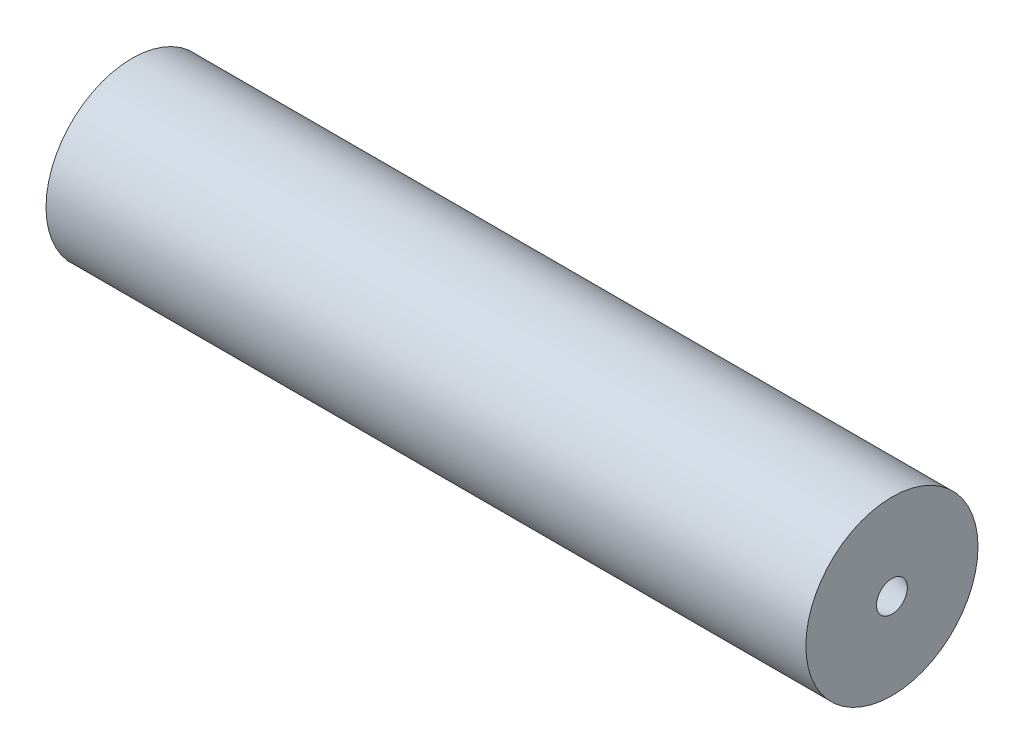
from build123d import *

# Parameters (mm, degrees)
CUT_EXTRUDE1_REACH = 247.25
SKETCH3_R          = 0.80645


with BuildPart() as part:
    # Sketch1 → Revolve1 (revolve)
    with BuildSketch(Plane.XY):
        Polygon((0, 12.7), (196.85, 12.7), (196.85, 26.162), (241.3, 26.162), (241.3, 0), (259.36, 0), (259.36, 10.7696), (273.6661, 5.5626), (273.6661, 31), (0, 31), align=None)
    revolve(axis=Axis((0, 0, 0), (1, 0, 0)))

    # Sketch3 → Cut-Extrude1 (cut, up to next)
    with BuildSketch(Plane.ZY.offset(-241.3), mode=Mode.PRIVATE) as cut_extrude1_sk1:
        with Locations((0, 6.477)):
            Circle(SKETCH3_R)
    cut_extrude1_tool1 = extrude(cut_extrude1_sk1.sketch, amount=-CUT_EXTRUDE1_REACH, mode=Mode.PRIVATE) & part.part
    # Sketch3 → Cut-Extrude1 (cut, up to next)
    with BuildSketch(Plane.ZY.offset(-241.3), mode=Mode.PRIVATE) as cut_extrude1_sk2:
        with Locations((4.579930622, 4.579930622)):
            Circle(SKETCH3_R)
    cut_extrude1_tool2 = extrude(cut_extrude1_sk2.sketch, amount=-CUT_EXTRUDE1_REACH, mode=Mode.PRIVATE) & part.part
    # Sketch3 → Cut-Extrude1 (cut, up to next)
    with BuildSketch(Plane.ZY.offset(-241.3), mode=Mode.PRIVATE) as cut_extrude1_sk3:
        with Locations((6.477, 0)):
            Circle(SKETCH3_R)
    cut_extrude1_tool3 = extrude(cut_extrude1_sk3.sketch, amount=-CUT_EXTRUDE1_REACH, mode=Mode.PRIVATE) & part.part
    # Sketch3 → Cut-Extrude1 (cut, up to next)
    with BuildSketch(Plane.ZY.offset(-241.3), mode=Mode.PRIVATE) as cut_extrude1_sk4:
        with Locations((4.579930622, -4.579930622)):
            Circle(SKETCH3_R)
    cut_extrude1_tool4 = extrude(cut_extrude1_sk4.sketch, amount=-CUT_EXTRUDE1_REACH, mode=Mode.PRIVATE) & part.part
    # Sketch3 → Cut-Extrude1 (cut, up to next)
    with BuildSketch(Plane.ZY.offset(-241.3), mode=Mode.PRIVATE) as cut_extrude1_sk5:
        with Locations((0, -6.477)):
            Circle(SKETCH3_R)
    cut_extrude1_tool5 = extrude(cut_extrude1_sk5.sketch, amount=-CUT_EXTRUDE1_REACH, mode=Mode.PRIVATE) & part.part
    # Sketch3 → Cut-Extrude1 (cut, up to next)
    with BuildSketch(Plane.ZY.offset(-241.3), mode=Mode.PRIVATE) as cut_extrude1_sk6:
        with Locations((-4.579930622, -4.579930622)):
            Circle(SKETCH3_R)
    cut_extrude1_tool6 = extrude(cut_extrude1_sk6.sketch, amount=-CUT_EXTRUDE1_REACH, mode=Mode.PRIVATE) & part.part
    # Sketch3 → Cut-Extrude1 (cut, up to next)
    with BuildSketch(Plane.ZY.offset(-241.3), mode=Mode.PRIVATE) as cut_extrude1_sk7:
        with Locations((-6.477, 0)):
            Circle(SKETCH3_R)
    cut_extrude1_tool7 = extrude(cut_extrude1_sk7.sketch, amount=-CUT_EXTRUDE1_REACH, mode=Mode.PRIVATE) & part.part
    # Sketch3 → Cut-Extrude1 (cut, up to next)
    with BuildSketch(Plane.ZY.offset(-241.3), mode=Mode.PRIVATE) as cut_extrude1_sk8:
        with Locations((-4.579930622, 4.579930622)):
            Circle(SKETCH3_R)
    cut_extrude1_tool8 = extrude(cut_extrude1_sk8.sketch, amount=-CUT_EXTRUDE1_REACH, mode=Mode.PRIVATE) & part.part
    add(cut_extrude1_tool1.solids().sort_by_distance((241.3, 6.477, 0))[0], mode=Mode.SUBTRACT)
    add(cut_extrude1_tool2.solids().sort_by_distance((241.3, 4.579931, 4.579931))[0], mode=Mode.SUBTRACT)
    add(cut_extrude1_tool3.solids().sort_by_distance((241.3, 0, 6.477))[0], mode=Mode.SUBTRACT)
    add(cut_extrude1_tool4.solids().sort_by_distance((241.3, -4.579931, 4.579931))[0], mode=Mode.SUBTRACT)
    add(cut_extrude1_tool5.solids().sort_by_distance((241.3, -6.477, 0))[0], mode=Mode.SUBTRACT)
    add(cut_extrude1_tool6.solids().sort_by_distance((241.3, -4.579931, -4.579931))[0], mode=Mode.SUBTRACT)
    add(cut_extrude1_tool7.solids().sort_by_distance((241.3, 0, -6.477))[0], mode=Mode.SUBTRACT)
    add(cut_extrude1_tool8.solids().sort_by_distance((241.3, 4.579931, -4.579931))[0], mode=Mode.SUBTRACT)


solid = part.part
